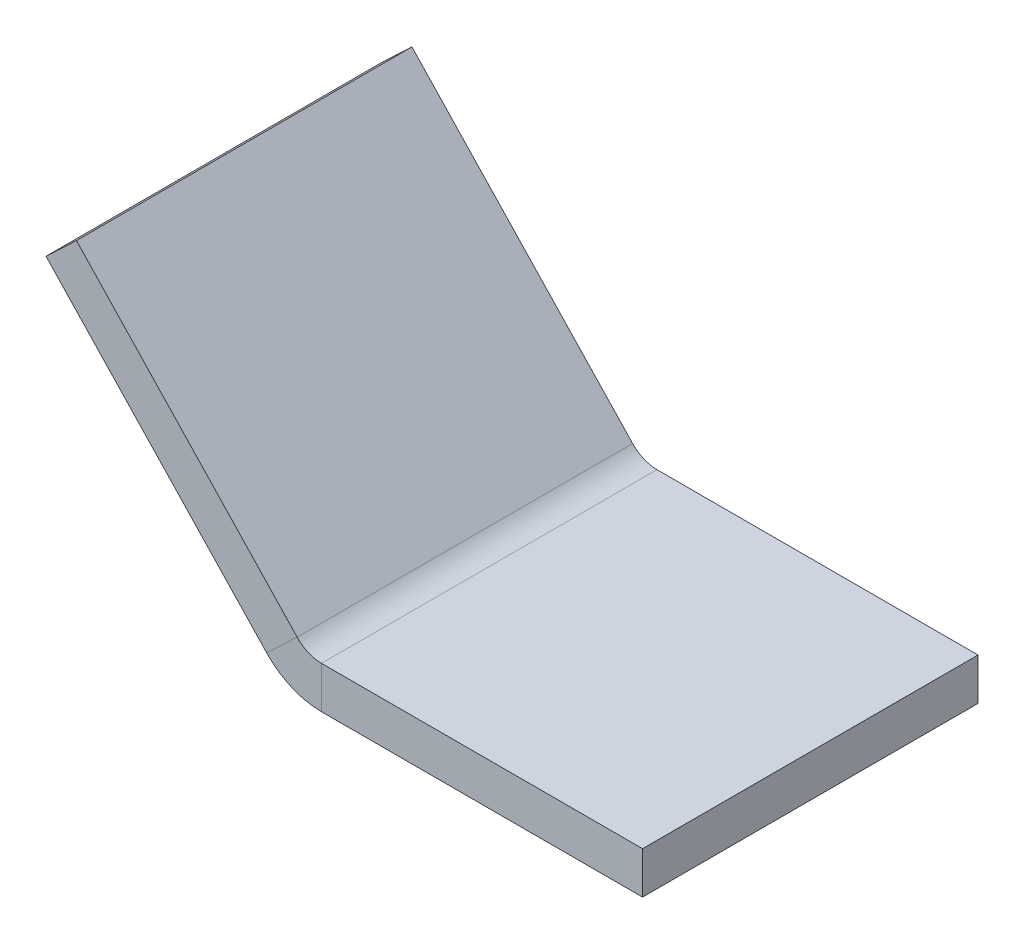
from build123d import *

# Parameters (mm, degrees)
BASE_FLANGE1_DEPTH = 12.7


# Sheet-metal steps are written as plain solids
with BuildPart() as part:
    # Sketch2 → Base-Flange1 (new body)
    with BuildSketch(Plane.XY):
        with BuildLine():
            Line((-8.731249857, 9.222541728), (-0.375733178, 0.396875014))
            ThreePointArc((-0.375733178, 0.396875014), (0.044509407, 0.103430514), (0.546520995, 0))
            Line((0.546520995, 0), (12.7, 0))
            Line((12.7, 0), (12.7, -1.5875))
            Line((12.7, -1.5875), (0.546520995, -1.5875))
            ThreePointArc((0.546520995, -1.5875), (-0.583005077, -1.354781344), (-1.528550894, -0.694531218))
            Line((-1.528550894, -0.694531218), (-9.884067573, 8.131135496))
            Line((-9.884067573, 8.131135496), (-8.731249857, 9.222541728))
        make_face()
    extrude(amount=BASE_FLANGE1_DEPTH)


solid = part.part
